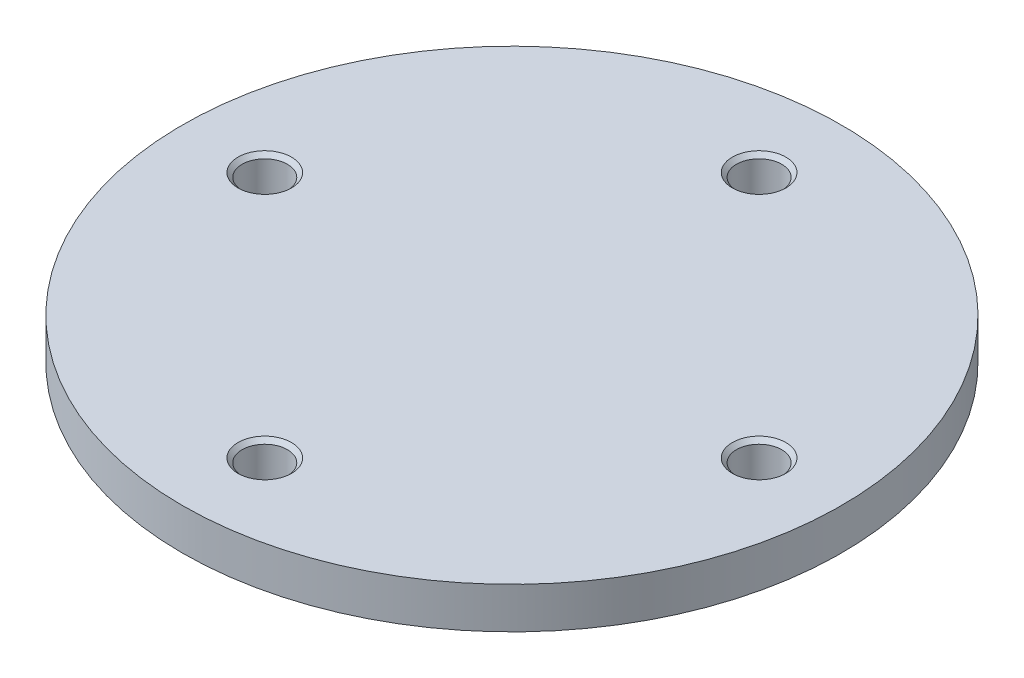
from build123d import *

# Parameters (mm, degrees)
SKETCH_1_R          = 6
SKETCH_1_R_2        = 2.5
EXTRUDE_1_DEPTH     = 21
SKETCH_2_R          = 40
EXTRUDE_2_DEPTH     = 5
CHAMFER_1_SIZE      = 10
SKETCH_3_R          = 2.75
CUT_EXTRUDE_2_DEPTH = 5
CHAMFER_2_SIZE      = 0.5


with BuildPart() as part:
    # 草图1 → 凸台-拉伸1 (new body)
    with BuildSketch(Plane(origin=(0, 0, 0), x_dir=(1, 0, 0), z_dir=(0, 1, 0))):
        Circle(SKETCH_1_R)
        Circle(SKETCH_1_R_2, mode=Mode.SUBTRACT)
    extrude(amount=EXTRUDE_1_DEPTH)

    # 草图2 → 凸台-拉伸2 (add)
    with BuildSketch(Plane(origin=(0, 21, 0), x_dir=(1, 0, 0), z_dir=(0, 1, 0))):
        Circle(SKETCH_2_R)
    extrude(amount=EXTRUDE_2_DEPTH)

    # 倒角1
    chamfer_1_edges = [part.edges().sort_by_distance(p)[0] for p in [
        (-6, 21, 0),
    ]]
    chamfer(chamfer_1_edges, length=CHAMFER_1_SIZE)

    # 草图3 → 切除-拉伸2 (cut)
    with BuildSketch(Plane(origin=(0, 26, 0), x_dir=(1, 0, 0), z_dir=(0, 1, 0))):
        with Locations((0, 30)):
            Circle(SKETCH_3_R)
        with Locations((30, 0)):
            Circle(SKETCH_3_R)
        with Locations((0, -30)):
            Circle(SKETCH_3_R)
        with Locations((-30, 0)):
            Circle(SKETCH_3_R)
    extrude(amount=-CUT_EXTRUDE_2_DEPTH, mode=Mode.SUBTRACT)

    # 倒角2
    chamfer_2_edges = [part.edges().sort_by_distance(p)[0] for p in [
        (-2.75, 26, 30),
        (-32.75, 26, 0),
        (-2.75, 26, -30),
        (27.25, 26, 0),
    ]]
    chamfer(chamfer_2_edges, length=CHAMFER_2_SIZE)


solid = part.part
